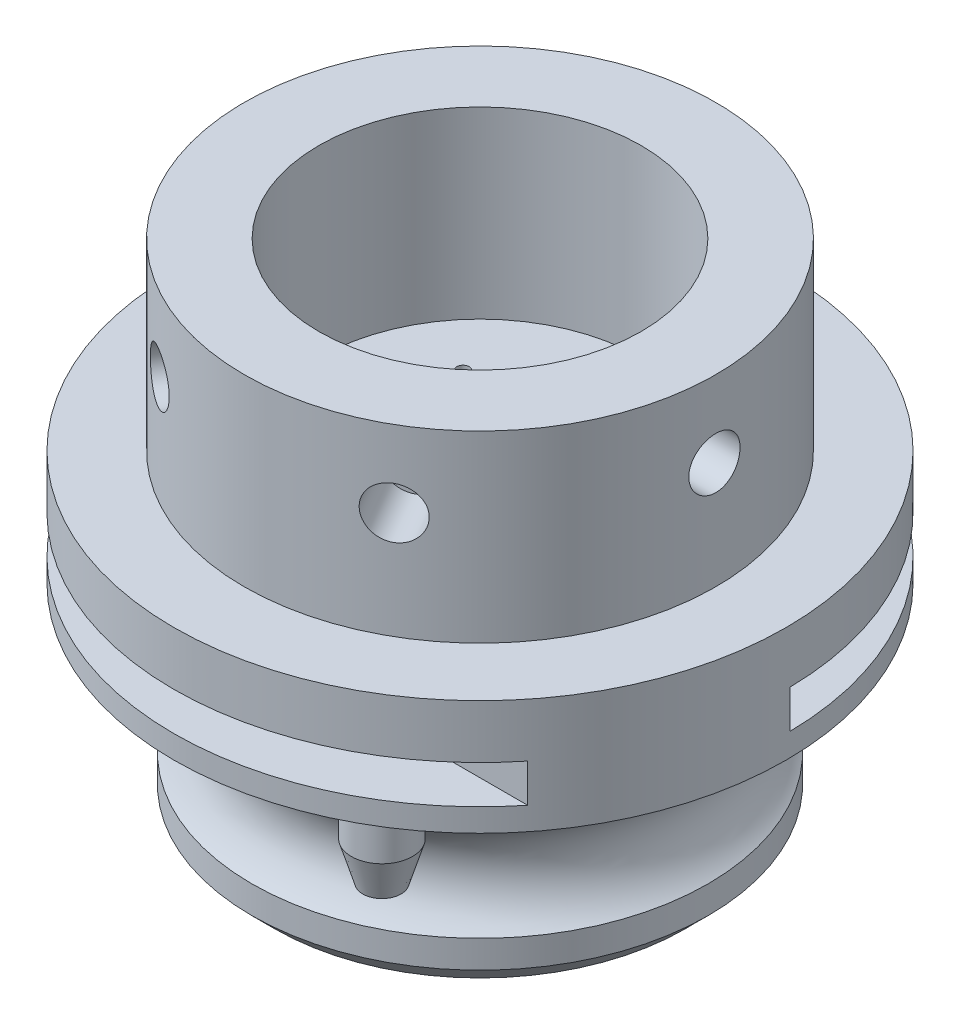
from build123d import *

# Parameters (mm, degrees)
SKETCH1_R             = 29.8
SKETCH1_R_2           = 20.2
BOSS_EXTRUDE1_DEPTH   = 25.7
SKETCH3_R             = 40
BOSS_EXTRUDE2_DEPTH   = 15
SKETCH4_R             = 4
BOSS_EXTRUDE3_DEPTH   = 5
SKETCH6_R             = 2.5
CUT_EXTRUDE1_START    = -12
CUT_EXTRUDE1_DEPTH    = 5
CUT_EXTRUDE6_DEPTH    = 3.2
SKETCH15_W            = 16.44
SKETCH15_H            = 4.4
CUT_EXTRUDE7_DEPTH    = 63.132841557
SKETCH16_R            = 0.8
CUT_EXTRUDE8_DEPTH    = 64.523302811
CUT_EXTRUDE11_DEPTH   = 8.5
BOSS_EXTRUDE4_DEPTH   = 3.5
BOSS_EXTRUDE4_2_DEPTH = 3.5
SKETCH20_R            = 30.8
SKETCH20_R_2          = 21.05
BOSS_EXTRUDE5_DEPTH   = 24
SKETCH22_R            = 3.35
CUT_EXTRUDE12_DEPTH   = 8
CIRPATTERN1_COUNT     = 6


with BuildPart() as part:
    # Sketch1 → Boss-Extrude1 (new body)
    with BuildSketch(Plane(origin=(0, 0, 0), x_dir=(1, 0, 0), z_dir=(0, 1, 0))):
        with Locations(Location((0, 0, 0), (0, 0, 90))):
            Circle(SKETCH1_R)
        with Locations(Location((0, 0, 0), (0, 0, 90))):
            Circle(SKETCH1_R_2, mode=Mode.SUBTRACT)
    extrude(amount=BOSS_EXTRUDE1_DEPTH)

    # Sketch2 → Cut-Revolve1 (revolve, cut)
    with BuildSketch(Plane.XY, mode=Mode.PRIVATE) as cut_revolve1_sk:
        with BuildLine():
            Line((29.8, 12.7), (29.8, 18.799180273))
            ThreePointArc((29.8, 18.799180273), (27.590586132, 16.098529094), (26.8, 12.7))
            Line((26.8, 12.7), (29.8, 12.7))
        make_face()
        with BuildLine():
            Line((29.8, 6.600819727), (29.8, 12.7))
            Line((29.8, 12.7), (26.8, 12.7))
            ThreePointArc((26.8, 12.7), (27.590586132, 9.301470906), (29.8, 6.600819727))
        make_face()
        Polygon((29.8, 3), (26.8, 0), (29.8, 0), align=None)
    revolve(cut_revolve1_sk.sketch.rotate(Axis((0, 25.7, 0), (0, -1, 0)), 270), axis=Axis((0, 25.7, 0), (0, -1, 0)), mode=Mode.SUBTRACT)

    # Sketch3 → Boss-Extrude2 (add)
    with BuildSketch(Plane(origin=(0, 25.7, 0), x_dir=(1, 0, 0), z_dir=(0, 1, 0))):
        with Locations(Location((0, 0, 0), (0, 0, 270))):
            Circle(SKETCH3_R)
    extrude(amount=BOSS_EXTRUDE2_DEPTH)

    # Sketch4 → Boss-Extrude3 (add)
    with BuildSketch(Plane(origin=(0, 25.7, 0), x_dir=(-1, 0, 0), z_dir=(0, -1, 0))):
        with Locations(Location((-17.5, -30.310889132, 0), (0, 0, 270))):
            Circle(SKETCH4_R)
        with Locations(Location((32.889241728, -11.970705016, 0), (0, 0, 270))):
            Circle(SKETCH4_R)
        with Locations(Location((-6.077686218, 34.468271355, 0), (0, 0, 270))):
            Circle(SKETCH4_R)
    extrude(amount=BOSS_EXTRUDE3_DEPTH)

    # Sketch6 → section 1 of loft1
    with BuildSketch(Plane(origin=(0, 15.7, 0), x_dir=(-1, 0, 0), z_dir=(0, -1, 0)), mode=Mode.PRIVATE) as loft1_s1:
        with Locations((32.889241728, -11.970705016)):
            Circle(SKETCH6_R)
    # loft from a face of the part (loft1)
    loft([part.faces().sort_by_distance((-32.889241728, 20.7, 11.970705016))[0], loft1_s1.sketch])

    # Boundary1: read off the stored shape, not the designer's step
    # Boundary1 outline → Boundary1 (revolve)
    with BuildSketch(Plane(origin=(17.5, 0, 30.310889132), x_dir=(1, 0, 0), z_dir=(0, 0, 1))):
        Polygon((0, 20.7), (0, 15.7), (2.5, 15.7), (4, 20.7), align=None)
    revolve(axis=Axis((17.5, 0, 30.310889132), (0, 1, 0)))

    # Boundary2: read off the stored shape, not the designer's step
    # Boundary2: loft between two sections, ruled curve by curve
    boundary2_from = [
        Edge.make_bspline([(9.922742778, 20.7, -33.365756026), (9.778423859, 20.7, -32.862439299), (9.289775651, 20.7, -31.913155977), (8.067478825, 20.7, -30.878607721), (6.542374051, 20.7, -30.390384874), (4.946413374, 20.7, -30.522974824), (3.522746317, 20.7, -31.256212676), (2.488002725, 20.7, -32.478460941), (1.999820352, 20.7, -34.003603594), (2.132382571, 20.7, -35.599531113), (2.865650923, 20.7, -37.023214684), (4.087837179, 20.7, -38.057933438), (5.613033755, 20.7, -38.546155237), (7.208931106, 20.7, -38.413575903), (8.632657493, 20.7, -37.680313497), (9.667322676, 20.7, -36.45811299), (10.155689167, 20.7, -34.933056337), (10.067061697, 20.7, -33.869072752), (9.922742778, 20.7, -33.365756026)], [0, 0, 0, 0, 0.0625, 0.125, 0.1875, 0.25, 0.3125, 0.375, 0.4375, 0.5, 0.5625, 0.625, 0.6875, 0.75, 0.8125, 0.875, 0.9375, 1, 1, 1, 1], 3),
    ]
    boundary2_to = [
        Edge.make_bspline([(8.313438837, 15.7, -33.349606871), (8.167005998, 15.7, -33.056947538), (7.757868808, 15.7, -32.529805617), (6.88811309, 15.7, -32.034506513), (5.895137902, 15.7, -31.909602819), (4.929849468, 15.7, -32.174234081), (4.139348951, 15.7, -32.788112293), (3.643935799, 15.7, -33.657748526), (3.519005287, 15.7, -34.650828768), (3.783658552, 15.7, -35.616093907), (4.397524642, 15.7, -36.406629525), (5.26722668, 15.7, -36.902042852), (6.260254151, 15.7, -37.026934051), (7.225507947, 15.7, -36.762316146), (8.016039922, 15.7, -36.14841822), (8.511411727, 15.7, -35.27881634), (8.63646584, 15.7, -34.285761617), (8.459871676, 15.7, -33.642266205), (8.313438837, 15.7, -33.349606871)], [0, 0, 0, 0, 0.0625, 0.125, 0.1875, 0.25, 0.3125, 0.375, 0.4375, 0.5, 0.5625, 0.625, 0.6875, 0.75, 0.8125, 0.875, 0.9375, 1, 1, 1, 1], 3),
    ]
    boundary2 = Solid(Shell([*[Face.make_surface_from_curves(boundary2_from[k], boundary2_to[k]) for k in range(1)], Face(Wire(boundary2_from)), Face(Wire(boundary2_to))]))
    add(boundary2)

    # Sketch7 → Cut-Extrude1 (cut)
    with BuildSketch(Plane(origin=(0, 40.7, 0), x_dir=(1, 0, 0), z_dir=(0, 1, 0)).offset(CUT_EXTRUDE1_START)):
        with BuildLine():
            ThreePointArc((31.224989992, 25), (0, 40), (-31.224989992, 25))
            Line((-31.224989992, 25), (0, 25))
            Line((0, 25), (31.224989992, 25))
        make_face()
        with BuildLine():
            Line((-5.8e-08, -25), (-31.224989992, -25))
            ThreePointArc((-31.224989992, -25), (0, -40), (31.224989992, -25))
            Line((31.224989992, -25), (-5.8e-08, -25))
        make_face()
        with BuildLine():
            Line((-19.515618745, -15.625), (-31.224989992, -25))
            Line((-31.224989992, -25), (-5.8e-08, -25))
            ThreePointArc((-5.8e-08, -25), (-10.825317574, -22.534695459), (-19.515618745, -15.625))
        make_face()
        with BuildLine():
            Line((-24.998227986, -0.297653397), (-39.997164778, -0.476245435))
            ThreePointArc((-39.997164778, -0.476245435), (-37.663011922, -13.472102025), (-31.224989992, -25))
            Line((-31.224989992, -25), (-19.515618745, -15.625))
            ThreePointArc((-19.515618745, -15.625), (-23.539382451, -8.420063766), (-24.998227986, -0.297653397))
        make_face()
        with BuildLine():
            ThreePointArc((39.997164778, 0.476245435), (37.663011922, 13.472102025), (31.224989992, 25))
            Line((31.224989992, 25), (19.515618745, 15.625))
            ThreePointArc((19.515618745, 15.625), (23.539382451, 8.420063766), (24.998227986, 0.297653397))
            Line((24.998227986, 0.297653397), (39.997164778, 0.476245435))
        make_face()
        with BuildLine():
            Line((31.224989992, 25), (0, 25))
            ThreePointArc((0, 25), (10.825317547, 22.534695472), (19.515618745, 15.625))
            Line((19.515618745, 15.625), (31.224989992, 25))
        make_face()
    extrude(amount=CUT_EXTRUDE1_DEPTH, mode=Mode.SUBTRACT)

    # Sketch14 → Cut-Extrude6 (cut)
    with BuildSketch(Plane(origin=(0, 25.7, 0), x_dir=(-1, 0, 0), z_dir=(0, -1, 0))):
        with BuildLine():
            Line((10.22, -2.2), (-10.22, -2.2))
            ThreePointArc((-10.22, -2.2), (-12.42, 0), (-10.22, 2.2))
            Line((-10.22, 2.2), (10.22, 2.2))
            ThreePointArc((10.22, 2.2), (12.42, 0), (10.22, -2.2))
        make_face()
        with BuildLine():
            Line((10.22, 10.2), (-10.22, 10.2))
            ThreePointArc((-10.22, 10.2), (-12.42, 8), (-10.22, 5.8))
            Line((-10.22, 5.8), (10.22, 5.8))
            ThreePointArc((10.22, 5.8), (12.42, 8), (10.22, 10.2))
        make_face()
        with BuildLine():
            Line((10.22, -5.8), (-10.22, -5.8))
            ThreePointArc((-10.22, -5.8), (-12.42, -8), (-10.22, -10.2))
            Line((-10.22, -10.2), (10.22, -10.2))
            ThreePointArc((10.22, -10.2), (12.42, -8), (10.22, -5.8))
        make_face()
    extrude(amount=-CUT_EXTRUDE6_DEPTH, mode=Mode.SUBTRACT)

    # Sketch15 → Cut-Extrude7 (cut, through all)
    with BuildSketch(Plane(origin=(0, 25.7, 0), x_dir=(-1, 0, 0), z_dir=(0, -1, 0))):
        Rectangle(SKETCH15_W, SKETCH15_H)
        with Locations((0, -8)):
            Rectangle(SKETCH15_W, SKETCH15_H)
        with Locations((0, 8)):
            Rectangle(SKETCH15_W, SKETCH15_H)
    extrude(amount=-CUT_EXTRUDE7_DEPTH, mode=Mode.SUBTRACT)

    # Sketch16 → Cut-Extrude8 (cut, through all)
    with BuildSketch(Plane(origin=(0, 28.9, 0), x_dir=(-1, 0, 0), z_dir=(0, -1, 0))):
        with Locations(Location((-10.22, -8, 0), (0, 0, 90))):
            Circle(SKETCH16_R)
        with Locations(Location((-10.22, 0, 0), (0, 0, 90))):
            Circle(SKETCH16_R)
        with Locations(Location((-10.22, 8, 0), (0, 0, 90))):
            Circle(SKETCH16_R)
        with Locations(Location((10.22, -8, 0), (0, 0, 90))):
            Circle(SKETCH16_R)
        with Locations(Location((10.22, 0, 0), (0, 0, 90))):
            Circle(SKETCH16_R)
        with Locations(Location((10.22, 8, 0), (0, 0, 90))):
            Circle(SKETCH16_R)
    extrude(amount=-CUT_EXTRUDE8_DEPTH, mode=Mode.SUBTRACT)

    # Sketch18 → Cut-Extrude11 (cut)
    with BuildSketch(Plane.XZ.offset(-25.7)):
        Polygon((-37.696941306, -9.542830615), (-34.387626292, -8.403342074), (-32.271433288, -14.549212815), (-35.580748302, -15.688701356), align=None)
    extrude(amount=-CUT_EXTRUDE11_DEPTH, mode=Mode.SUBTRACT)

    # Sketch20 → Boss-Extrude5 (add)
    with BuildSketch(Plane(origin=(0, 40.7, 0), x_dir=(1, 0, 0), z_dir=(0, 1, 0))):
        with Locations(Location((0, 0, 0), (0, 0, 270))):
            Circle(SKETCH20_R)
        with Locations(Location((0, 0, 0), (0, 0, 270))):
            Circle(SKETCH20_R_2, mode=Mode.SUBTRACT)
    extrude(amount=BOSS_EXTRUDE5_DEPTH)

    # Sketch22 → Cut-Extrude12 (cut)
    with BuildSketch(Plane.ZY.offset(30.8)):
        with Locations((0, 54.7)):
            Circle(SKETCH22_R)
    cut_extrude12 = extrude(amount=-CUT_EXTRUDE12_DEPTH, mode=Mode.SUBTRACT)

    # CirPattern1: Cut-Extrude12 ×6 about axis
    cirpattern1_axis = Axis((0, 0, 0), (0, 1, 0))
    for i in range(1, CIRPATTERN1_COUNT):
        add(cut_extrude12.rotate(cirpattern1_axis, i * 360 / CIRPATTERN1_COUNT), mode=Mode.SUBTRACT)


with BuildPart() as body_2:
    # Sketch19 → Boss-Extrude4 (new body)
    with BuildSketch(Plane(origin=(-33.32952979, 0, -11.476277445), x_dir=(-0.32556815445715764, 0, 0.9455185755993165), z_dir=(-0.9455185755993165, 0, -0.32556815445715764))):
        with BuildLine():
            ThreePointArc((0, 34.2), (2.298097039, 33.248097039), (3.25, 30.95))
            Line((3.25, 30.95), (3.25, 34.2))
            Line((3.25, 34.2), (0, 34.2))
        make_face()
    extrude(amount=BOSS_EXTRUDE4_DEPTH)


with BuildPart() as body_3:
    # Sketch19 → Boss-Extrude4 2 (new body)
    with BuildSketch(Plane(origin=(-33.32952979, 0, -11.476277445), x_dir=(-0.32556815445715764, 0, 0.9455185755993165), z_dir=(-0.9455185755993165, 0, -0.32556815445715764))):
        with BuildLine():
            ThreePointArc((-3.25, 30.95), (-2.298097039, 33.248097039), (0, 34.2))
            Line((0, 34.2), (-3.25, 34.2))
            Line((-3.25, 34.2), (-3.25, 30.95))
        make_face()
    extrude(amount=BOSS_EXTRUDE4_2_DEPTH)


solid = Compound([part.part, body_2.part, body_3.part])
